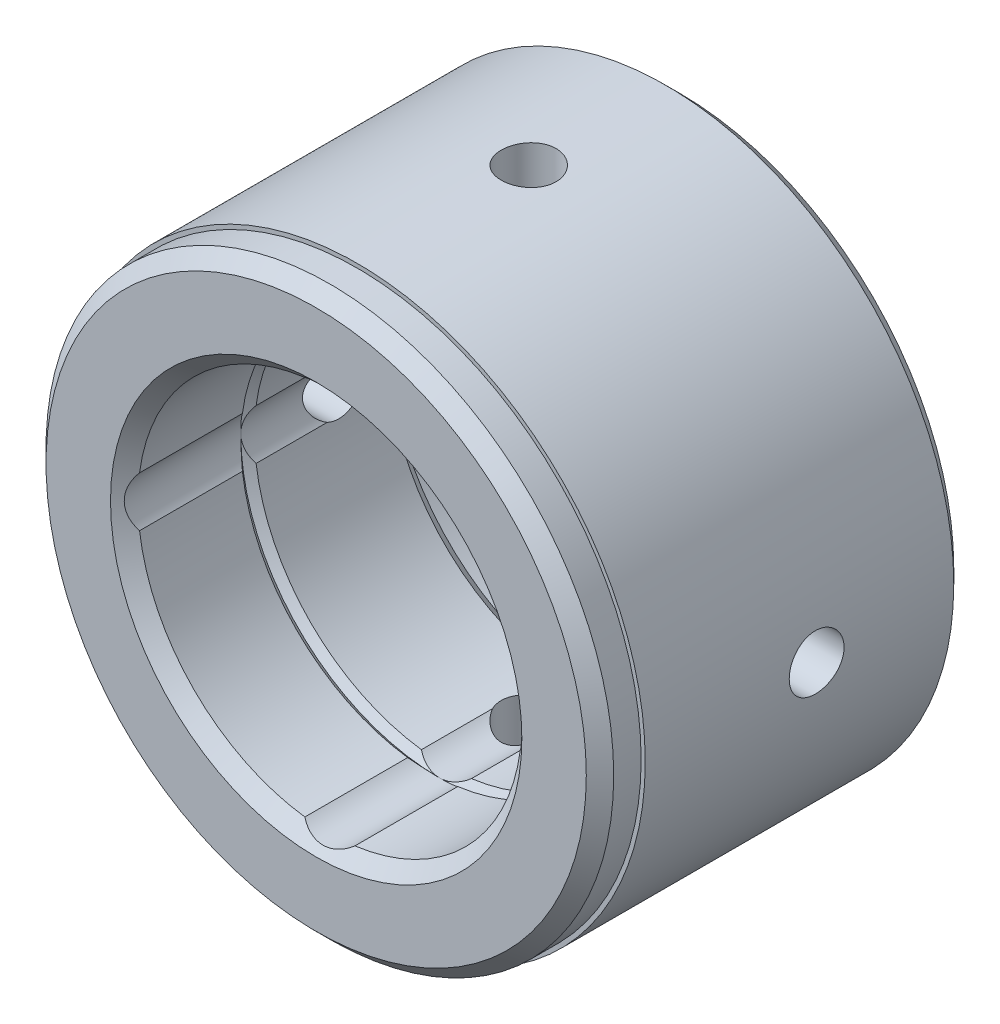
from build123d import *

# Parameters (mm, degrees)
SKETCH4_R          = 3
CUT_EXTRUDE1_DEPTH = 15.5
CIRPATTERN1_COUNT  = 4


with BuildPart() as part:
    # Sketch1 → Revolve1 (revolve)
    with BuildSketch(Plane(origin=(0, 0, 0), x_dir=(0, 0, -1), z_dir=(1, 0, 0))):
        Polygon((3, 21), (25.5, 21), (26.5, 20), (26.5, 19), (25.5, 18), (20.3, 18), (20.3, 15), (19.3, 14), (9.5, 14), (9, 14.5), (8.5, 14), (1, 14), (0, 15), (0, 19.7), (1, 20.7), (3, 20.7), align=None)
    revolve(axis=Axis((0, 0, 0), (0, 0, -1)))

    # Sketch2 → Ø4.0 (4) Diameter Hole1 (revolve, cut)
    with BuildSketch(Plane(origin=(0, 21, -15.5), x_dir=(0, 0, 1), z_dir=(1, 0, 0))):
        Polygon((0, 0), (0, 11.201721238), (2, 10), (2, 0), align=None)
    f_4_0_4_diameter_hole1 = revolve(axis=Axis((0, 27.35, -15.5), (0, -1, 0)), mode=Mode.SUBTRACT)

    # Sketch4 → Cut-Extrude1 (cut)
    with BuildSketch(Plane.XY):
        with Locations((0, 11.5)):
            Circle(SKETCH4_R)
    cut_extrude1 = extrude(amount=-CUT_EXTRUDE1_DEPTH, mode=Mode.SUBTRACT)

    # CirPattern1: Ø4.0 (4) Diameter Hole1, Cut-Extrude1 ×4 about axis
    cirpattern1_axis = Axis((0, 0, 0), (0, 0, 1))
    add([f_4_0_4_diameter_hole1.rotate(cirpattern1_axis, i * 360 / CIRPATTERN1_COUNT) for i in range(1, CIRPATTERN1_COUNT)], mode=Mode.SUBTRACT)
    add([cut_extrude1.rotate(cirpattern1_axis, i * 360 / CIRPATTERN1_COUNT) for i in range(1, CIRPATTERN1_COUNT)], mode=Mode.SUBTRACT)


solid = part.part
